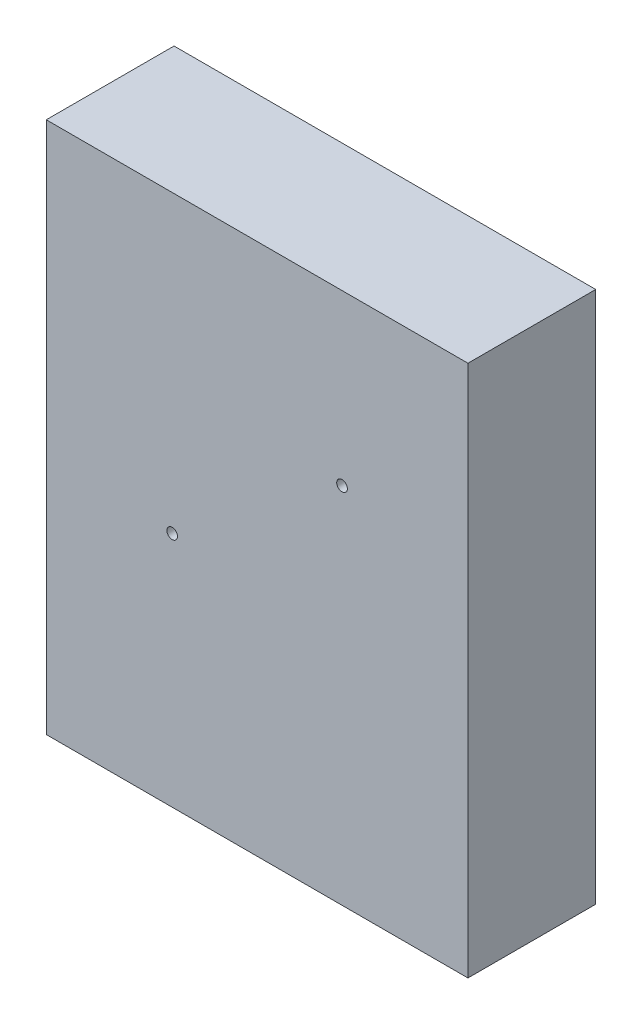
from build123d import *

# Parameters (mm, degrees)
SKETCH1_W           = 39.6
SKETCH1_H           = 50
BOSS_EXTRUDE1_DEPTH = 12
CUT_EXTRUDE1_REACH  = 66.901
SKETCH2_R           = 0.5
SKETCH3_R           = 0.5
CUT_EXTRUDE2_DEPTH  = 10


with BuildPart() as part:
    # Sketch1 → Boss-Extrude1 (new body)
    with BuildSketch(Plane.XY):
        with Locations((19.8, 25)):
            Rectangle(SKETCH1_W, SKETCH1_H)
    extrude(amount=BOSS_EXTRUDE1_DEPTH)

    # Sketch2 → Cut-Extrude1 (cut, up to next)
    with BuildSketch(Plane.XY.offset(12), mode=Mode.PRIVATE) as cut_extrude1_sk1:
        with Locations((11.825, 22.27)):
            Circle(SKETCH2_R)
    cut_extrude1_tool1 = extrude(cut_extrude1_sk1.sketch, amount=-CUT_EXTRUDE1_REACH, mode=Mode.PRIVATE) & part.part
    # Sketch2 → Cut-Extrude1 (cut, up to next)
    with BuildSketch(Plane.XY.offset(12), mode=Mode.PRIVATE) as cut_extrude1_sk2:
        with Locations((27.775, 34.125)):
            Circle(SKETCH2_R)
    cut_extrude1_tool2 = extrude(cut_extrude1_sk2.sketch, amount=-CUT_EXTRUDE1_REACH, mode=Mode.PRIVATE) & part.part
    add(cut_extrude1_tool1.solids().sort_by_distance((11.825, 22.27, 12))[0], mode=Mode.SUBTRACT)
    add(cut_extrude1_tool2.solids().sort_by_distance((27.775, 34.125, 12))[0], mode=Mode.SUBTRACT)

    # Sketch3 → Cut-Extrude2 (cut)
    with BuildSketch(Plane.XZ):
        with Locations((5, 6)):
            Circle(SKETCH3_R)
        with Locations((20, 6)):
            Circle(SKETCH3_R)
    extrude(amount=-CUT_EXTRUDE2_DEPTH, mode=Mode.SUBTRACT)


solid = part.part
